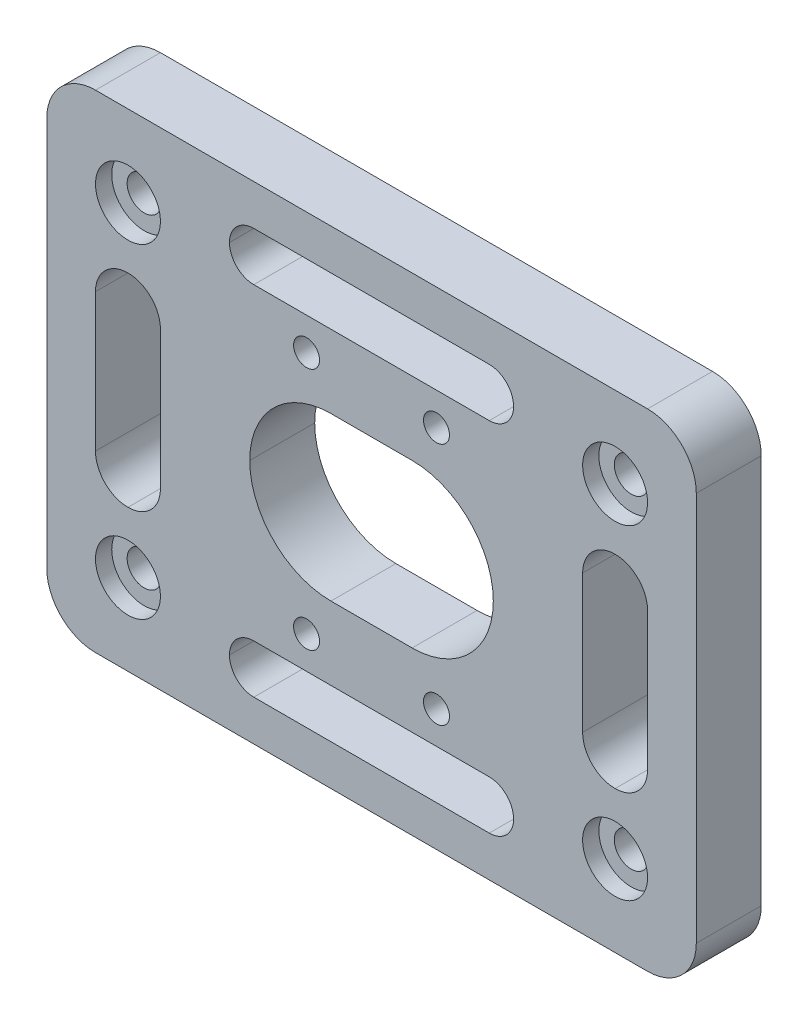
from build123d import *

# Parameters (mm, degrees)
SKETCH_1_W             = 80
SKETCH_1_H             = 60
SKETCH_1_R             = 2.1
SKETCH_1_R_2           = 1.6
EXTRUDE_2_DEPTH        = 8
SKETCH_1_3_R           = 3
CUT_EXTRUDE_2_DEPTH    = 3.5
FILLET_1_R             = 6
SKETCH_1_4_W           = 35
SKETCH_1_4_H           = 6
CUT_EXTRUDE_3_DEPTH    = 62.395513597
FILLET_2_R             = 3
FILLET_2_OF_MIRROR_1_R = 3
SKETCH_1_5_W           = 8
SKETCH_1_5_H           = 25
CUT_EXTRUDE_4_DEPTH    = 62.395513597
FILLET_3_R             = 4
FILLET_3_OF_MIRROR_2_R = 4
SKETCH_2_R             = 4
CUT_EXTRUDE_5_DEPTH    = 2
SKETCH_3_W             = 30
SKETCH_3_H             = 20
CUT_EXTRUDE_6_DEPTH    = 10
FILLET_4_R             = 10


with BuildPart() as part:
    # 草图1 → 凸台-拉伸2 (new body)
    with BuildSketch(Plane.XY):
        with Locations((-10.979166634, -3.26460069)):
            Rectangle(SKETCH_1_W, SKETCH_1_H)
        with Locations((-40.979166634, 16.73539931)):
            Circle(SKETCH_1_R, mode=Mode.SUBTRACT)
        with Locations(Location((19.020833366, 16.73539931, 0), (0, 0, 180))):
            Circle(SKETCH_1_R, mode=Mode.SUBTRACT)
        with Locations((19.020833366, -23.26460069)):
            Circle(SKETCH_1_R, mode=Mode.SUBTRACT)
        with Locations(Location((-40.979166634, -23.26460069, 0), (0, 0, 180))):
            Circle(SKETCH_1_R, mode=Mode.SUBTRACT)
        with Locations((-18.979166634, 11.73539931)):
            Circle(SKETCH_1_R_2, mode=Mode.SUBTRACT)
        with Locations(Location((-2.979166634, 11.73539931, 0), (0, 0, 180))):
            Circle(SKETCH_1_R_2, mode=Mode.SUBTRACT)
        with Locations((-2.979166634, -18.26460069)):
            Circle(SKETCH_1_R_2, mode=Mode.SUBTRACT)
        with Locations(Location((-18.979166634, -18.26460069, 0), (0, 0, 180))):
            Circle(SKETCH_1_R_2, mode=Mode.SUBTRACT)
    extrude(amount=EXTRUDE_2_DEPTH)

    # 草图1<3> → 切除-拉伸2 (cut)
    with BuildSketch(Plane.XY):
        with Locations((-18.979166634, 11.73539931)):
            Circle(SKETCH_1_3_R)
        with Locations(Location((-2.979166634, 11.73539931, 0), (0, 0, 180))):
            Circle(SKETCH_1_3_R)
        with Locations((-2.979166634, -18.26460069)):
            Circle(SKETCH_1_3_R)
        with Locations(Location((-18.979166634, -18.26460069, 0), (0, 0, 180))):
            Circle(SKETCH_1_3_R)
    extrude(amount=CUT_EXTRUDE_2_DEPTH, mode=Mode.SUBTRACT)

    # 圆角1
    fillet_1_edges = [part.edges().sort_by_distance(p)[0] for p in [
        (-50.979166634, 26.73539931, 4),
        (-50.979166634, -33.26460069, 4),
        (29.020833366, -33.26460069, 4),
        (29.020833366, 26.73539931, 4),
    ]]
    fillet(fillet_1_edges, radius=FILLET_1_R)

    # 草图1<4> → 切除-拉伸3 (cut, through all)
    with BuildSketch(Plane.XY):
        with Locations((-10.979166634, 18.73539931)):
            Rectangle(SKETCH_1_4_W, SKETCH_1_4_H)
    cut_extrude_3 = extrude(amount=CUT_EXTRUDE_3_DEPTH, mode=Mode.SUBTRACT)

    # 圆角2
    fillet_2_edges = [part.edges().sort_by_distance(p)[0] for p in [
        (6.520833366, 15.73539931, 4),
        (6.520833366, 21.73539931, 4),
        (-28.479166634, 15.73539931, 4),
        (-28.479166634, 21.73539931, 4),
    ]]
    fillet(fillet_2_edges, radius=FILLET_2_R - 0.0001)  # a hair under: the kernel refuses the full size

    # 镜向1: 切除-拉伸3 across plane
    add(cut_extrude_3.mirror(Plane.ZX.offset(-3.26460069)), mode=Mode.SUBTRACT)

    # 圆角2 of 镜向1
    fillet_2_of_mirror_1_edges = [part.edges().sort_by_distance(p)[0] for p in [
        (6.520833366, -22.26460069, 4),
        (6.520833366, -28.26460069, 4),
        (-28.479166634, -22.26460069, 4),
        (-28.479166634, -28.26460069, 4),
    ]]
    fillet(fillet_2_of_mirror_1_edges, radius=FILLET_2_OF_MIRROR_1_R - 0.0001)  # a hair under: the kernel refuses the full size

    # 草图1<5> → 切除-拉伸4 (cut, through all)
    with BuildSketch(Plane.XY):
        with Locations((-40.979166634, -3.26460069)):
            Rectangle(SKETCH_1_5_W, SKETCH_1_5_H)
    cut_extrude_4 = extrude(amount=CUT_EXTRUDE_4_DEPTH, mode=Mode.SUBTRACT)

    # 圆角3
    fillet_3_edges = [part.edges().sort_by_distance(p)[0] for p in [
        (-36.979166634, -15.76460069, 4),
        (-44.979166634, -15.76460069, 4),
        (-36.979166634, 9.23539931, 4),
        (-44.979166634, 9.23539931, 4),
    ]]
    fillet(fillet_3_edges, radius=FILLET_3_R - 0.0001)  # a hair under: the kernel refuses the full size

    # 镜向2: 切除-拉伸4 across plane
    add(cut_extrude_4.mirror(Plane.ZY.offset(10.979166634)), mode=Mode.SUBTRACT)

    # 圆角3 of 镜向2
    fillet_3_of_mirror_2_edges = [part.edges().sort_by_distance(p)[0] for p in [
        (15.020833366, -15.76460069, 4),
        (23.020833366, -15.76460069, 4),
        (15.020833366, 9.23539931, 4),
        (23.020833366, 9.23539931, 4),
    ]]
    fillet(fillet_3_of_mirror_2_edges, radius=FILLET_3_OF_MIRROR_2_R - 0.0001)  # a hair under: the kernel refuses the full size

    # 草图2 → 切除-拉伸5 (cut)
    with BuildSketch(Plane.XY.offset(8)):
        with Locations((-40.979166634, 16.73539931)):
            Circle(SKETCH_2_R)
        with Locations(Location((19.020833366, 16.73539931, 0), (0, 0, 180))):
            Circle(SKETCH_2_R)
        with Locations((19.020833366, -23.26460069)):
            Circle(SKETCH_2_R)
        with Locations(Location((-40.979166634, -23.26460069, 0), (0, 0, 180))):
            Circle(SKETCH_2_R)
    extrude(amount=-CUT_EXTRUDE_5_DEPTH, mode=Mode.SUBTRACT)

    # 草图3 → 切除-拉伸6 (cut)
    with BuildSketch(Plane.XY.offset(8)):
        with Locations((-10.979166634, -3.26460069)):
            Rectangle(SKETCH_3_W, SKETCH_3_H)
    extrude(amount=-CUT_EXTRUDE_6_DEPTH, mode=Mode.SUBTRACT)

    # 圆角4
    fillet_4_edges = [part.edges().sort_by_distance(p)[0] for p in [
        (4.020833366, -13.26460069, 4),
        (-25.979166634, -13.26460069, 4),
        (4.020833366, 6.73539931, 4),
        (-25.979166634, 6.73539931, 4),
    ]]
    fillet(fillet_4_edges, radius=FILLET_4_R - 0.0001)  # a hair under: the kernel refuses the full size


solid = part.part
